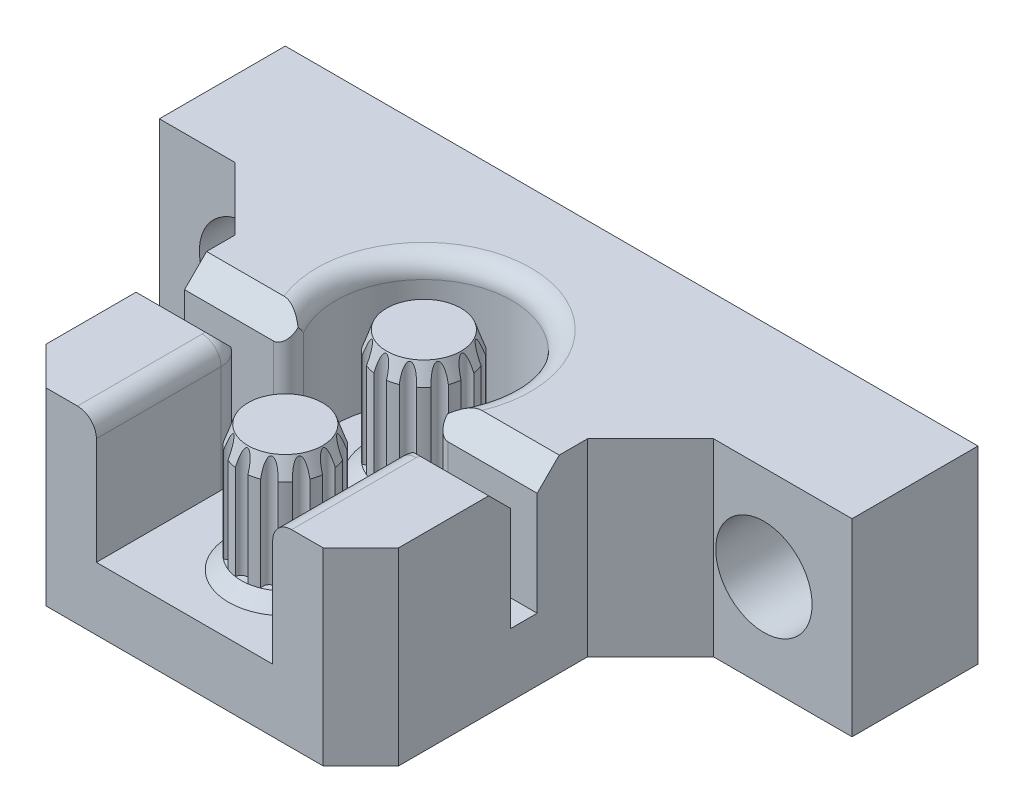
from build123d import *
from OCP.BRepFilletAPI import BRepFilletAPI_MakeChamfer

# Parameters (mm, degrees)
BOSS_EXTRUDE1_DEPTH = 15
SKETCH4_R           = 1.8500000000000327
SKETCH4_R_2         = 1.8500000000000325
CUT_EXTRUDE1_DEPTH  = 16
SKETCH5_R           = 3.825000000000017
SKETCH5_R_2         = 3.8249999999999593
CUT_EXTRUDE2_DEPTH  = 6
SKETCH6_R           = 3.4999999999999676
CUT_EXTRUDE3_DEPTH  = 10
CHAMFER1_SIZE       = 1
CHAMFER2_SIZE       = 1.5
CHAMFER2_SIZE2      = 0.5459553513993048
FILLET1_R           = 1
FILLET2_R           = 2
CHAMFER3_SIZE       = 1.75
CHAMFER4_SIZE       = 5
CHAMFER5_SIZE       = 3
FILLET3_R           = 1.5
SKETCH8_R           = 0.49999999999991956
SKETCH8_R_2         = 0.5000000000000258
SKETCH8_R_3         = 0.49999999999967476
SKETCH8_R_4         = 0.4999999999998134
CUT_EXTRUDE4_DEPTH  = 9


with BuildPart() as part:
    # Sketch1 → Boss-Extrude1 (new body)
    with BuildSketch(Plane(origin=(0, 0, 0), x_dir=(1, 0, 0), z_dir=(0, 1, 0))):
        Polygon((491.08068814785025, 689.6450710523791), (480.08068814785025, 689.6450710523791), (480.08068814785025, 699.6450710523791), (535.0806881478503, 699.6450710523791), (535.0806881478504, 689.6450710523791), (519.0806881478503, 689.6450710523791), (519.0806881478503, 666.6450710523791), (491.0806881478503, 666.6450710523791), align=None)
    extrude(amount=BOSS_EXTRUDE1_DEPTH)

    # Sketch4 → Cut-Extrude1 (cut)
    with BuildSketch(Plane(origin=(0, 0, -699.6450710523791), x_dir=(-1, 0, 2.27e-15), z_dir=(-2.27e-15, 0, -1))):
        with Locations((-487.08068814785025, 7.5)):
            Circle(SKETCH4_R)
        with Locations((-528.0806881478502, 7.500000000000001)):
            Circle(SKETCH4_R_2)
    extrude(amount=-CUT_EXTRUDE1_DEPTH, mode=Mode.SUBTRACT)

    # Sketch5 → Cut-Extrude2 (cut)
    with BuildSketch(Plane.XY.offset(-689.6450710523791)):
        with Locations((487.0806881478503, 7.5)):
            Circle(SKETCH5_R)
        with Locations((528.0806881478502, 7.500000000000001)):
            Circle(SKETCH5_R_2)
    extrude(amount=-CUT_EXTRUDE2_DEPTH, mode=Mode.SUBTRACT)

    # Sketch6 → Cut-Extrude3 (cut)
    with BuildSketch(Plane(origin=(0, 15, 0), x_dir=(1, 0, 0), z_dir=(0, 1, 0))):
        with BuildLine():
            Line((491.08068814785025, 680.6450710523791), (500.1817086622837, 680.6450710523792))
            ThreePointArc((500.1817086622837, 680.6450710523792), (505.0806881478504, 692.6450710523791), (509.9796676334165, 680.645071052379))
            Line((509.9796676334165, 680.645071052379), (519.0806881478503, 680.6450710523791))
            Line((519.0806881478503, 680.6450710523791), (519.0806881478503, 678.5450710523791))
            Line((519.0806881478503, 678.5450710523791), (512.0806881478503, 678.5450710523791))
            Line((512.0806881478503, 678.5450710523791), (512.0806881478503, 666.6450710523791))
            Line((512.0806881478503, 666.6450710523791), (498.08068814785025, 666.6450710523791))
            Line((498.08068814785025, 666.6450710523791), (498.08068814785025, 678.5450710523791))
            Line((498.08068814785025, 678.5450710523791), (491.08068814785025, 678.5450710523791))
            Line((491.08068814785025, 678.5450710523791), (491.08068814785025, 680.6450710523791))
        make_face()
        with Locations(Location((505.08068814785025, 685.6450710523791, 0), (0, 0, 270))):
            Circle(SKETCH6_R, mode=Mode.SUBTRACT)
        with Locations(Location((506.08068814785025, 673.6450710523791, 0), (0, 0, 270))):
            Circle(SKETCH6_R, mode=Mode.SUBTRACT)
    extrude(amount=-CUT_EXTRUDE3_DEPTH, mode=Mode.SUBTRACT)

    # Chamfer1
    chamfer1_edges = [part.edges().sort_by_distance(p)[0] for p in [
        (506.08068814785025, 5, -677.1450710523791),
        (505.08068814785025, 5, -689.1450710523791),
    ]]
    chamfer(chamfer1_edges, length=CHAMFER1_SIZE)

    # Chamfer2: one chamfer whose edges measure the first distance from different faces: ONE call of the kernel's chamfer builder (chamfer() names one face for all edges)
    chamfer2_edges_1 = [part.edges().sort_by_distance(p)[0] for p in [
        (505.08068814785025, 15, -689.1450710523791),
    ]]
    chamfer2_side_1 = [part.faces().sort_by_distance(p)[0] for p in [
        (505.08068814785025, 10.5, -689.1450710523791),
    ]]
    chamfer2_edges_2 = [part.edges().sort_by_distance(p)[0] for p in [
        (506.08068814785025, 15, -677.1450710523791),
    ]]
    chamfer2_side_2 = [part.faces().sort_by_distance(p)[0] for p in [
        (506.08068814785025, 10.5, -677.1450710523791),
    ]]
    chamfer2 = BRepFilletAPI_MakeChamfer(part.part.solid().wrapped)
    for e in chamfer2_edges_1:
        chamfer2.Add(CHAMFER2_SIZE, CHAMFER2_SIZE2, e.wrapped, chamfer2_side_1[0].wrapped)  # the first distance lies on this face
    for e in chamfer2_edges_2:
        chamfer2.Add(CHAMFER2_SIZE, CHAMFER2_SIZE2, e.wrapped, chamfer2_side_2[0].wrapped)  # the first distance lies on this face
    add(Compound.cast(chamfer2.Shape()), mode=Mode.REPLACE)

    # Fillet1
    fillet1_edges = [part.edges().sort_by_distance(p)[0] for p in [
        (500.18170866228365, 10, -680.6450710523791),
        (509.9796676334165, 10, -680.6450710523791),
    ]]
    fillet(fillet1_edges, radius=FILLET1_R)

    # Fillet2
    fillet2_edges = [part.edges().sort_by_distance(p)[0] for p in [
        (512.0806881478503, 10, -678.5450710523791),
        (498.08068814785025, 10, -678.5450710523791),
    ]]
    fillet(fillet2_edges, radius=FILLET2_R)

    # Chamfer3
    # the kernel refuses this chamfer: 1.75 mm, written as the material it takes off along each edge
    with BuildSketch(Plane(origin=(500.5811333767907, 15, -678.5450710523791), x_dir=(0, -0.999621916911296, -0.027495876610613736), z_dir=(-1, 0, 0))) as chamfer3_piece_1:
        Polygon((CHAMFER3_SIZE * 0.999621916911, CHAMFER3_SIZE * 0.0274958766106), (-CHAMFER3_SIZE * 0.0274958766106, CHAMFER3_SIZE * 0.999621916911), (0, 0), align=None)
    extrude(amount=14.000890457880928, mode=Mode.SUBTRACT)
    with BuildSketch(Plane(origin=(523.5811333767908, 15, -678.5450710523791), x_dir=(0, -0.999621916911296, -0.027495876610613736), z_dir=(-1, 0, 0))) as chamfer3_piece_2:
        Polygon((CHAMFER3_SIZE * 0.999621916911, CHAMFER3_SIZE * 0.0274958766106), (-CHAMFER3_SIZE * 0.0274958766106, CHAMFER3_SIZE * 0.999621916911), (0, 0), align=None)
    extrude(amount=14.000890457880985, mode=Mode.SUBTRACT)
    with BuildSketch(Plane(origin=(507.5084461491851, 15, -680.645071052379), x_dir=(0, -0.999621916911296, 0.027495876610613736), z_dir=(1, 0, -1.249e-14))) as chamfer3_piece_3:
        Polygon((CHAMFER3_SIZE * 0.999621916911, CHAMFER3_SIZE * 0.0274958766106), (-CHAMFER3_SIZE * 0.0274958766106, CHAMFER3_SIZE * 0.999621916911), (0, 0), align=None)
    extrude(amount=16.07268722760574, mode=Mode.SUBTRACT)
    with BuildSketch(Plane(origin=(486.5802429189098, 15, -680.6450710523791), x_dir=(0, -0.999621916911296, 0.027495876610613736), z_dir=(1, 0, -1.249e-14))) as chamfer3_piece_4:
        Polygon((CHAMFER3_SIZE * 0.999621916911, CHAMFER3_SIZE * 0.0274958766106), (-CHAMFER3_SIZE * 0.0274958766106, CHAMFER3_SIZE * 0.999621916911), (0, 0), align=None)
    extrude(amount=16.07268722760523, mode=Mode.SUBTRACT)

    # Chamfer4
    # the kernel refuses this chamfer: 5 mm, written as the material it adds along each edge
    with BuildSketch(Plane(origin=(519.0806881478503, 0, -689.6450710523791), x_dir=(-0.027495876610582292, 0, 0.9996219169112969), z_dir=(0, 1, 0))) as chamfer4_piece_1:
        Polygon((CHAMFER4_SIZE * 0.999621916911, CHAMFER4_SIZE * 0.0274958766106), (-CHAMFER4_SIZE * 0.0274958766106, CHAMFER4_SIZE * 0.999621916911), (0, 0), align=None)
    extrude(amount=15)
    with BuildSketch(Plane(origin=(491.08068814785025, 0, -689.6450710523791), x_dir=(0.027495876610582292, 0, 0.9996219169112969), z_dir=(0, 1, 0))) as chamfer4_piece_2_section:
        Polygon((CHAMFER4_SIZE * 0.999621916911, -CHAMFER4_SIZE * 0.0274958766106), (-CHAMFER4_SIZE * 0.0274958766106, -CHAMFER4_SIZE * 0.999621916911), (0, 0), align=None)
    chamfer4_piece_2 = extrude(amount=15, mode=Mode.PRIVATE)
    chamfer4_piece_2 = chamfer4_piece_2 - Plane(origin=(487.0806881478503, 7.5, -685.4206792543918), x_dir=(1, 0, 0), z_dir=(0, 0, 1)) * Cylinder(3.825000000000017, 50, mode=Mode.PRIVATE)
    add(chamfer4_piece_2)

    # Chamfer5
    chamfer5_edges = [part.edges().sort_by_distance(p)[0] for p in [
        (519.0806881478503, 7.5, -666.6450710523791),
        (491.0806881478503, 7.5, -666.6450710523791),
    ]]
    chamfer(chamfer5_edges, length=CHAMFER5_SIZE)

    # Fillet3
    # the kernel refuses this fillet: 1.5 mm, written as the material it takes off along each edge
    with BuildSketch(Plane(origin=(514.0806881478503, 15, -676.5450710523791), x_dir=(-1, 0, 0), z_dir=(0, 0, 1))) as fillet3_piece_1:
        with BuildLine():
            CenterArc((2 - FILLET3_R, FILLET3_R), FILLET3_R, 270, 90)
            Line((2, FILLET3_R), (2, 0))
            Line((2, 0), (2 - FILLET3_R, 0))
        make_face()
    revolve(axis=Axis((514.0806881478503, 15, -676.5450710523791), (0, -1, 0)), revolution_arc=114.61061701149393, mode=Mode.SUBTRACT)
    with BuildSketch(Plane(origin=(496.08068814785025, 15, -676.5450710523791), x_dir=(-0.41644926820676414, 0, -0.9091589558542833), z_dir=(-0.9091589558542833, 0, 0.41644926820676414))) as fillet3_piece_2:
        with BuildLine():
            CenterArc((1.9999999999996112 - FILLET3_R, FILLET3_R), FILLET3_R, 270, 90)
            Line((1.9999999999996112, FILLET3_R), (1.9999999999996112, 0))
            Line((1.9999999999996112, 0), (1.9999999999996112 - FILLET3_R, 0))
        make_face()
    revolve(axis=Axis((496.08068814785025, 15, -676.5450710523791), (0, -1, 0)), revolution_arc=114.61061701148994, mode=Mode.SUBTRACT)
    with BuildSketch(Plane(origin=(512.0806881478503, 15, -676.5450710523791), x_dir=(1, 0, 0), z_dir=(0, 0, 1))) as fillet3_piece_3:
        with BuildLine():
            CenterArc((FILLET3_R, -FILLET3_R), FILLET3_R, 90, 90)
            Line((0, -FILLET3_R), (0, 0))
            Line((0, 0), (FILLET3_R, 0))
        make_face()
    extrude(amount=13.649999999999977, mode=Mode.SUBTRACT)
    with BuildSketch(Plane(origin=(498.08068814785025, 15, -662.8950710523791), x_dir=(-1, 0, 0), z_dir=(0, 0, -1))) as fillet3_piece_4:
        with BuildLine():
            CenterArc((FILLET3_R, -FILLET3_R), FILLET3_R, 90, 90)
            Line((0, -FILLET3_R), (0, 0))
            Line((0, 0), (FILLET3_R, 0))
        make_face()
    extrude(amount=13.649999999999977, mode=Mode.SUBTRACT)
    with BuildSketch(Plane(origin=(505.0806881478501, 15, -685.6450710523791), x_dir=(-0.5233523316876699, 0, 0.8521163869549037), z_dir=(0.8521163869549037, 0, 0.5233523316876699))) as fillet3_piece_5:
        with BuildLine():
            CenterArc((7.0000000000058265 + FILLET3_R, FILLET3_R), FILLET3_R, 180, 90)
            Line((7.000000000005857, FILLET3_R), (7.0000000000058265, 0))
            Line((7.0000000000058265, 0), (7.0000000000058265 + FILLET3_R, 0))
        make_face()
    revolve(axis=Axis((505.0806881478501, 15, -685.6450710523791), (0, -1, 0)), revolution_arc=296.88522175781696, mode=Mode.SUBTRACT)

    # Sketch8 → Cut-Extrude4 (cut)
    with BuildSketch(Plane(origin=(0, 15, 0), x_dir=(1, 0, 0), z_dir=(0, 1, 0))):
        with Locations((501.5806881478503, 685.6450710523791)):
            Circle(SKETCH8_R)
        with Locations((502.0495992346048, 687.3950710523789)):
            Circle(SKETCH8_R_2)
        with Locations((503.3306881478503, 688.6761599656245)):
            Circle(SKETCH8_R_3)
        with Locations((505.08068814785014, 689.1450710523789)):
            Circle(SKETCH8_R)
        with Locations((506.83068814785014, 688.6761599656246)):
            Circle(SKETCH8_R)
        with Locations((508.11177706109555, 687.3950710523791)):
            Circle(SKETCH8_R)
        with Locations((508.5806881478503, 685.645071052379)):
            Circle(SKETCH8_R)
        with Locations((508.11177706109567, 683.8950710523791)):
            Circle(SKETCH8_R_2)
        with Locations((506.83068814785014, 682.6139821391337)):
            Circle(SKETCH8_R_4)
        with Locations((505.08068814785025, 682.1450710523791)):
            Circle(SKETCH8_R)
        with Locations((503.3306881478502, 682.6139821391334)):
            Circle(SKETCH8_R)
        with Locations((502.0495992346048, 683.8950710523791)):
            Circle(SKETCH8_R)
        with Locations((502.5806881478503, 673.6450710523791)):
            Circle(SKETCH8_R)
        with Locations((503.04959923460444, 675.3950710523789)):
            Circle(SKETCH8_R_4)
        with Locations((504.3306881478502, 676.6761599656245)):
            Circle(SKETCH8_R)
        with Locations((506.08068814785014, 677.145071052379)):
            Circle(SKETCH8_R)
        with Locations((507.83068814785014, 676.6761599656246)):
            Circle(SKETCH8_R)
        with Locations((509.11177706109567, 675.3950710523791)):
            Circle(SKETCH8_R_4)
        with Locations((509.5806881478503, 673.645071052379)):
            Circle(SKETCH8_R)
        with Locations((509.1117770610958, 671.8950710523792)):
            Circle(SKETCH8_R_4)
        with Locations((507.83068814785025, 670.6139821391337)):
            Circle(SKETCH8_R_4)
        with Locations((506.08068814785014, 670.1450710523791)):
            Circle(SKETCH8_R_4)
        with Locations((504.3306881478502, 670.6139821391334)):
            Circle(SKETCH8_R)
        with Locations((503.04959923460467, 671.895071052379)):
            Circle(SKETCH8_R_2)
    extrude(amount=-CUT_EXTRUDE4_DEPTH, mode=Mode.SUBTRACT)


solid = part.part
